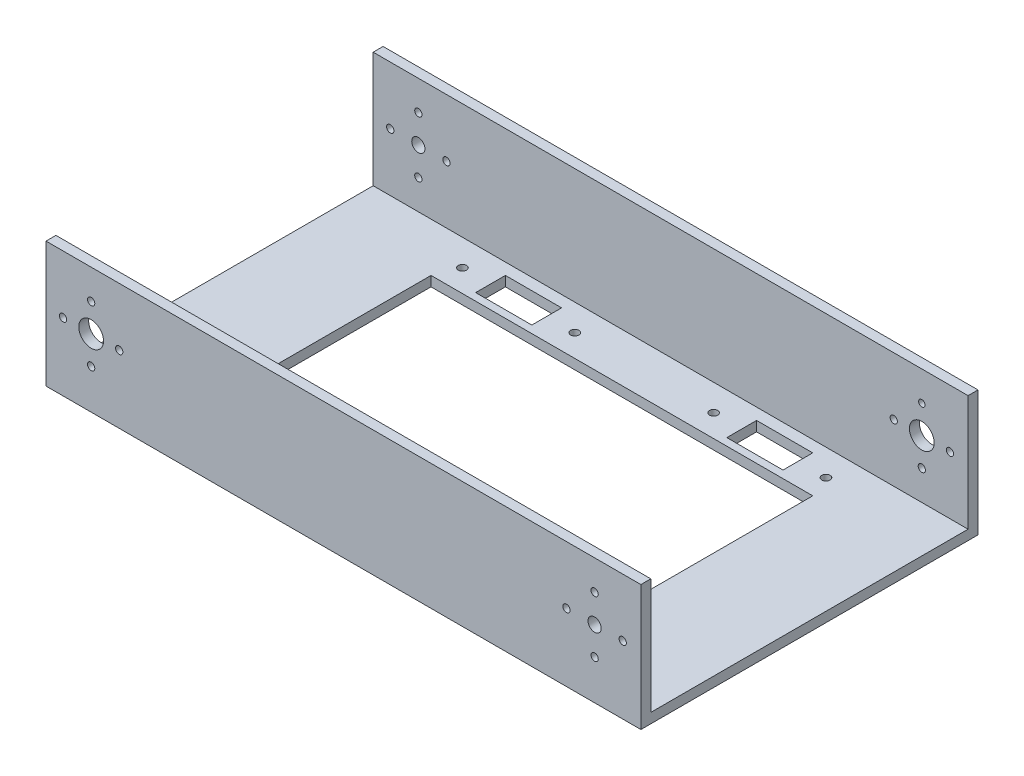
from build123d import *

# Parameters (mm, degrees)
SKETCH_1_W          = 180
SKETCH_1_H          = 35
EXTRUDE_1_DEPTH     = 3
SKETCH_2_R          = 3.75
SKETCH_2_R_2        = 2
CUT_EXTRUDE_1_DEPTH = 3
SKETCH_3_R          = 1.1
CUT_EXTRUDE_2_DEPTH = 3
SKETCH_4_W          = 180
SKETCH_4_H          = 102
EXTRUDE_2_DEPTH     = 3
SKETCH_5_W          = 180
SKETCH_5_H          = 3
EXTRUDE_3_DEPTH     = 35
CUT_EXTRUDE_START   = -35
SKETCH_6_R          = 3.75
SKETCH_6_R_2        = 2
SKETCH_6_R_3        = 1.1
SKETCH_6_R_4        = 0.981653735
CUT_EXTRUDE_3_DEPTH = 35
SKETCH_9_W          = 115.5
SKETCH_9_H          = 66.5
CUT_EXTRUDE_4_DEPTH = 10
SKETCH_10_R         = 1.25
CUT_EXTRUDE_5_DEPTH = 10
SKETCH_11_R         = 1.25
SKETCH_11_W         = 17
SKETCH_11_H         = 9
CUT_EXTRUDE_6_DEPTH = 10


with BuildPart() as part:
    # 스케치1 → 보스-돌출1 (new body)
    with BuildSketch(Plane.XY):
        Rectangle(SKETCH_1_W, SKETCH_1_H)
    extrude(amount=EXTRUDE_1_DEPTH)

    # 스케치2 → 컷-돌출1 (cut)
    with BuildSketch(Plane.XY.offset(3)):
        with Locations((-76.33997629, 0)):
            Circle(SKETCH_2_R)
        with Locations((76, 0)):
            Circle(SKETCH_2_R_2)
    extrude(amount=-CUT_EXTRUDE_1_DEPTH, mode=Mode.SUBTRACT)

    # 스케치3 → 컷-돌출2 (cut)
    with BuildSketch(Plane.XY.offset(3)):
        with Locations((-76.33997629, 8.5)):
            Circle(SKETCH_3_R)
        with Locations((-76.33997629, -8.5)):
            Circle(SKETCH_3_R)
        with Locations((-84.83997629, 0)):
            Circle(SKETCH_3_R)
        with Locations((-67.83997629, 0)):
            Circle(SKETCH_3_R)
        with Locations((76, 8.5)):
            Circle(SKETCH_3_R)
        with Locations((76, -8.5)):
            Circle(SKETCH_3_R)
        with Locations((67.5, 0)):
            Circle(SKETCH_3_R)
        with Locations((84.5, 0)):
            Circle(SKETCH_3_R)
    extrude(amount=-CUT_EXTRUDE_2_DEPTH, mode=Mode.SUBTRACT)

    # 스케치4 → 보스-돌출2 (add)
    with BuildSketch(Plane.XZ.offset(17.5)):
        with Locations((0, -48)):
            Rectangle(SKETCH_4_W, SKETCH_4_H)
    extrude(amount=EXTRUDE_2_DEPTH)

    # 스케치5 → 보스-돌출3 (add)
    with BuildSketch(Plane(origin=(0, -17.5, 0), x_dir=(1, 0, 0), z_dir=(0, 1, 0))):
        with Locations((0, 97.5)):
            Rectangle(SKETCH_5_W, SKETCH_5_H)
    extrude(amount=EXTRUDE_3_DEPTH)

    # 스케치6 → 컷-돌출3 (cut)
    with BuildSketch(Plane(origin=(0, 0, -99), x_dir=(-1, 0, 0), z_dir=(0, 0, -1)).offset(CUT_EXTRUDE_START)):
        with Locations((-76, 0)):
            Circle(SKETCH_6_R)
        with Locations((76.33997629, 0)):
            Circle(SKETCH_6_R_2)
        with Locations((-76, -8.5)):
            Circle(SKETCH_6_R_3)
        with Locations((-67.5, 0)):
            Circle(SKETCH_6_R_3)
        with Locations((-76, 8.5)):
            Circle(SKETCH_6_R_4)
        with Locations((-84.5, 0)):
            Circle(SKETCH_6_R_3)
        with Locations((84.83997629, 0)):
            Circle(SKETCH_6_R_3)
        with Locations((76.33997629, 8.5)):
            Circle(SKETCH_6_R_3)
        with Locations((67.83997629, 0)):
            Circle(SKETCH_6_R_3)
        with Locations((76.33997629, -8.5)):
            Circle(SKETCH_6_R_3)
    extrude(amount=CUT_EXTRUDE_3_DEPTH, mode=Mode.SUBTRACT)

    # 스케치9 → 컷-돌출4 (cut)
    with BuildSketch(Plane(origin=(0, -17.5, 0), x_dir=(1, 0, 0), z_dir=(0, 1, 0))):
        with Locations((0, 48)):
            Rectangle(SKETCH_9_W, SKETCH_9_H)
    extrude(amount=-CUT_EXTRUDE_4_DEPTH, mode=Mode.SUBTRACT)

    # 스케치10 → 컷-돌출5 (cut)
    with BuildSketch(Plane.XZ.offset(20.5)):
        with Locations((-55, -8)):
            Circle(SKETCH_10_R)
        with Locations((55, -8)):
            Circle(SKETCH_10_R)
        with Locations((55, -88)):
            Circle(SKETCH_10_R)
        with Locations((-55, -88)):
            Circle(SKETCH_10_R)
    extrude(amount=-CUT_EXTRUDE_5_DEPTH, mode=Mode.SUBTRACT)

    # 스케치11 → 컷-돌출6 (cut)
    with BuildSketch(Plane.XZ.offset(20.5)):
        with Locations((21, -8)):
            Circle(SKETCH_11_R)
        with Locations((-21, -8)):
            Circle(SKETCH_11_R)
        with Locations((21, -88)):
            Circle(SKETCH_11_R)
        with Locations((-21, -88)):
            Circle(SKETCH_11_R)
        with Locations((38, -88)):
            Rectangle(SKETCH_11_W, SKETCH_11_H)
        with Locations((-38, -88)):
            Rectangle(SKETCH_11_W, SKETCH_11_H)
        with Locations((38, -8)):
            Rectangle(SKETCH_11_W, SKETCH_11_H)
        with Locations((-38, -8)):
            Rectangle(SKETCH_11_W, SKETCH_11_H)
    extrude(amount=-CUT_EXTRUDE_6_DEPTH, mode=Mode.SUBTRACT)


solid = part.part
